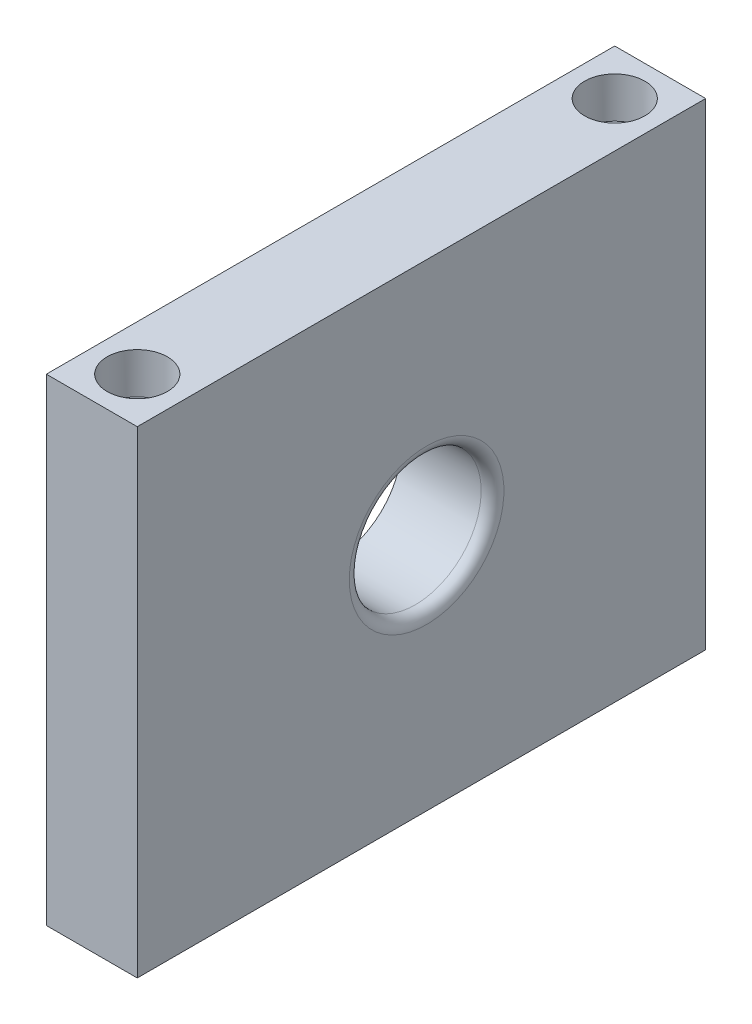
from build123d import *

# Parameters (mm, degrees)
SKETCH1_W           = 25
SKETCH1_H           = 50
SKETCH1_R           = 3.4
BOSS_EXTRUDE1_DEPTH = 3
SKETCH2_W           = 50
SKETCH2_H           = 3
BOSS_EXTRUDE2_DEPTH = 8
SKETCH3_W           = 8
SKETCH3_H           = 50
BOSS_EXTRUDE3_DEPTH = 42
SKETCH4_R           = 2.65
CUT_EXTRUDE1_DEPTH  = 6.6
SKETCH5_R           = 5.802370205
CUT_EXTRUDE2_DEPTH  = 9
FILLET2_R           = 1
SKETCH6_R           = 12.6
BOSS_EXTRUDE4_DEPTH = 2
FILLET4_R           = 1
SKETCH8_R           = 1.589780168
SKETCH8_R_2         = 1.777428262
CUT_EXTRUDE3_DEPTH  = 10
SKETCH9_W           = 49.021678163
SKETCH9_H           = 20.976854622
CUT_EXTRUDE4_DEPTH  = 68.79439129
SKETCH10_R          = 1.4
CUT_EXTRUDE5_DEPTH  = 56.950783118


with BuildPart() as part:
    # Sketch1 → Boss-Extrude1 (new body)
    with BuildSketch(Plane(origin=(0, 0, 0), x_dir=(1, 0, 0), z_dir=(0, 1, 0))):
        with Locations((2.276951673, 11.384758364)):
            Rectangle(SKETCH1_W, SKETCH1_H)
        with Locations(Location((1.276951673, 11.384758364, 0), (0, 0, 270))):
            Circle(SKETCH1_R, mode=Mode.SUBTRACT)
    extrude(amount=BOSS_EXTRUDE1_DEPTH)

    # Sketch2 → Boss-Extrude2 (add)
    with BuildSketch(Plane.ZY.offset(10.223048327)):
        with Locations((-11.384758364, 1.5)):
            Rectangle(SKETCH2_W, SKETCH2_H)
    extrude(amount=BOSS_EXTRUDE2_DEPTH)

    # Sketch3 → Boss-Extrude3 (add)
    with BuildSketch(Plane.XZ):
        with Locations((-14.223048327, -11.384758364)):
            Rectangle(SKETCH3_W, SKETCH3_H)
    extrude(amount=BOSS_EXTRUDE3_DEPTH)

    # Sketch4 → Cut-Extrude1 (cut)
    with BuildSketch(Plane(origin=(0, 3, 0), x_dir=(1, 0, 0), z_dir=(0, 1, 0))):
        with Locations(Location((-14.223048327, 32.384758364, 0), (0, 0, 270))):
            Circle(SKETCH4_R)
        with Locations(Location((-14.223048327, -9.615241636, 0), (0, 0, 270))):
            Circle(SKETCH4_R)
    cut_extrude1 = extrude(amount=-CUT_EXTRUDE1_DEPTH, mode=Mode.SUBTRACT)

    # Mirror1: Cut-Extrude1 across plane
    add(cut_extrude1.mirror(Plane.ZX.offset(-19.5)), mode=Mode.SUBTRACT)

    # Sketch5 → Cut-Extrude2 (cut)
    with BuildSketch(Plane.ZY.offset(18.223048327)):
        with Locations((-11.836279124, -21)):
            Circle(SKETCH5_R)
    extrude(amount=-CUT_EXTRUDE2_DEPTH, mode=Mode.SUBTRACT)

    # Fillet2
    fillet2_edges = [part.edges().sort_by_distance(p)[0] for p in [
        (-10.223048327, -21, -17.638649329),
    ]]
    fillet(fillet2_edges, radius=FILLET2_R)

    # Mirror2: Cut-Extrude1 across plane
    add(cut_extrude1.mirror(Plane.ZY.offset(1.723048327)), mode=Mode.SUBTRACT)

    # Sketch6 → Boss-Extrude4 (add)
    with BuildSketch(Plane(origin=(0, 3, 0), x_dir=(1, 0, 0), z_dir=(0, 1, 0))):
        with BuildLine():
            Line((14.776951673, 5.825082115), (14.776951673, 16.944434614))
            ThreePointArc((14.776951673, 16.944434614), (-13.323048327, 11.384758364), (14.776951673, 5.825082115))
        make_face()
        with Locations(Location((1.276951673, 11.384758364, 0), (0, 0, 270))):
            Circle(SKETCH6_R, mode=Mode.SUBTRACT)
    extrude(amount=BOSS_EXTRUDE4_DEPTH)

    # Fillet4
    # the kernel refuses this fillet: 1 mm, written as the material it takes off along each edge
    with BuildSketch(Plane(origin=(14.776951673, 5, -3.325082115), x_dir=(0, -1, 0), z_dir=(0, 0, -1))) as fillet4_piece_1:
        with BuildLine():
            CenterArc((FILLET4_R, FILLET4_R), FILLET4_R, 180, 90)
            Line((0, FILLET4_R), (0, 0))
            Line((0, 0), (FILLET4_R, 0))
        make_face()
    extrude(amount=16.119352499, mode=Mode.SUBTRACT)

    # Sketch8 → Cut-Extrude3 (cut)
    with BuildSketch(Plane(origin=(0, 3, 0), x_dir=(1, 0, 0), z_dir=(0, 1, 0))):
        with Locations(Location((1.276951673, 19.884758364, 0), (0, 0, 270))):
            Circle(SKETCH8_R)
        with Locations(Location((1.276951673, 2.884758364, 0), (0, 0, 270))):
            Circle(SKETCH8_R_2)
    extrude(amount=-CUT_EXTRUDE3_DEPTH, mode=Mode.SUBTRACT)

    # Sketch9 → Cut-Extrude4 (cut, through all)
    with BuildSketch(Plane.XY.offset(13.615241636)):
        with Locations((-9.733887409, 10.488427311)):
            Rectangle(SKETCH9_W, SKETCH9_H)
    extrude(amount=-CUT_EXTRUDE4_DEPTH, mode=Mode.SUBTRACT)

    # Sketch10 → Cut-Extrude5 (cut, through all)
    with BuildSketch(Plane(origin=(0, -3.6, 0), x_dir=(1, 0, 0), z_dir=(0, 1, 0))):
        with Locations(Location((-14.223048327, 32.384758364, 0), (0, 0, 270))):
            Circle(SKETCH10_R)
    cut_extrude5 = extrude(amount=-CUT_EXTRUDE5_DEPTH, mode=Mode.SUBTRACT)

    # Mirror3: Cut-Extrude5 across plane
    add(cut_extrude5.mirror(Plane.XY.offset(-11.384758364)), mode=Mode.SUBTRACT)


solid = part.part
